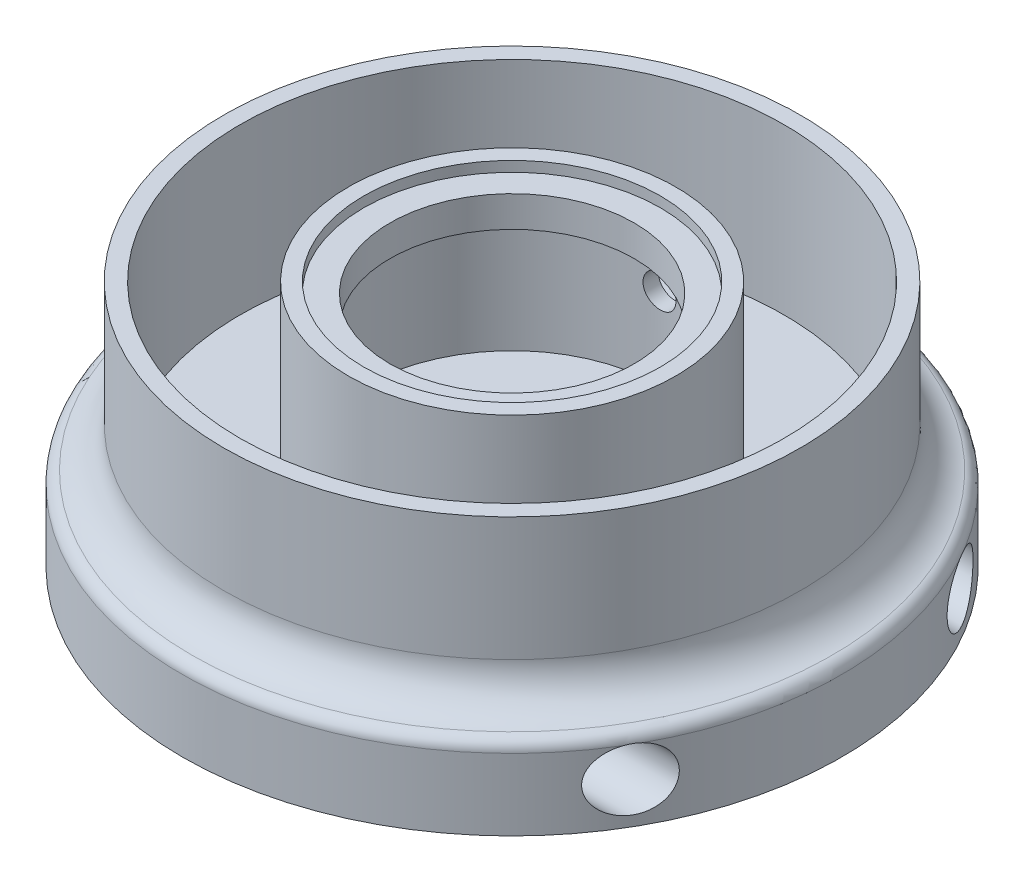
from build123d import *
from build123d.topology import SkipClean

# Parameters (mm, degrees)
SKETCH1_R               = 101.6
BOSS_EXTRUDE1_DEPTH     = 25.4
SKETCH4_R               = 88.9
SKETCH4_R_2             = 83.82
BOSS_EXTRUDE2_DEPTH     = 50.8
CUT_EXTRUDE4_DEPTH      = 101.6
CUT_EXTRUDE4_DEPTH_BACK = 101.6
SKETCH2_R               = 9.525
FILLET7_R               = 12.7
FILLET8_R               = 3.81
SKETCH11_R              = 50.4825
SKETCH11_R_2            = 45.72
BOSS_EXTRUDE5_DEPTH     = 50.8
SKETCH13_W              = 8.068772826
SKETCH13_H              = 9.525
SKETCH14_R              = 5.08
CUT_EXTRUDE5_DEPTH      = 50.8


# Some blends are built 0.0001 mm under size
with BuildPart() as part:
    # Sketch1 → Boss-Extrude1 (new body)
    with BuildSketch(Plane(origin=(0, 0, 0), x_dir=(1, 0, 0), z_dir=(0, 1, 0))):
        with Locations(Location((0, 0, 0), (0, 0, 270))):
            Circle(SKETCH1_R)
    extrude(amount=BOSS_EXTRUDE1_DEPTH)

    # Sketch4 → Boss-Extrude2 (add)
    with BuildSketch(Plane(origin=(0, 25.4, 0), x_dir=(1, 0, 0), z_dir=(0, 1, 0))):
        with Locations(Location((0, 0, 0), (0, 0, 270))):
            Circle(SKETCH4_R)
        with Locations(Location((0, 0, 0), (0, 0, 270))):
            Circle(SKETCH4_R_2, mode=Mode.SUBTRACT)
    extrude(amount=BOSS_EXTRUDE2_DEPTH)

    # Sketch2 → Cut-Extrude4 (cut, two sides: drawn at the far end of the back side and taken through both)
    with BuildSketch(Plane(origin=(0, 0, 0), x_dir=(0, 0, -1), z_dir=(1, 0, 0)).offset(-CUT_EXTRUDE4_DEPTH_BACK)):
        with Locations(Location((50.8, 12.7, 0), (0, 0, 180))):
            Circle(SKETCH2_R)
        with Locations(Location((-50.8, 12.7, 0), (0, 0, 180))):
            Circle(SKETCH2_R)
    extrude(amount=CUT_EXTRUDE4_DEPTH + CUT_EXTRUDE4_DEPTH_BACK, mode=Mode.SUBTRACT)

    # Fillet7
    fillet7_edges = [part.edges().sort_by_distance(p)[0] for p in [
        (0, 25.4, -88.9),
    ]]
    fillet(fillet7_edges, radius=FILLET7_R - 0.0001)  # a hair under: the kernel refuses the full size

    # Fillet8
    # the kernel refuses this fillet: 3.81 mm, written as the material it takes off along each edge
    with BuildSketch(Plane(origin=(0, 25.4, 0), x_dir=(0, 0, 1), z_dir=(-1, 0, 0))) as fillet8_piece_1:
        with BuildLine():
            CenterArc((97.79, -3.364391457), FILLET8_R, 360, 76.657910561)
            Line((101.6, -3.364391457), (101.981, -3.364391457))
            Line((101.981, -3.364391457), (101.981, 0))
            Line((101.981, 0), (101.6, 0.381))
            ThreePointArc((101.6, 0.381), (101.5999, 0.381), (98.757134319, 0.713491843))
            Line((98.757134319, 0.713491843), (98.669213018, 0.34277518))
        make_face()
    revolve(axis=Axis((0, 25.4, 0), (0, 1, 0)), mode=Mode.SUBTRACT)

    # Sketch11 → Boss-Extrude5 (add)
    with SkipClean():  # the faces are left unmerged after this step: merging them gives an invalid solid
        with BuildSketch(Plane(origin=(0, 25.4, 0), x_dir=(1, 0, 0), z_dir=(0, 1, 0))):
            with Locations(Location((0, 0, 0), (0, 0, 270))):
                Circle(SKETCH11_R)
            with Locations(Location((0, 0, 0), (0, 0, 270))):
                Circle(SKETCH11_R_2, mode=Mode.SUBTRACT)
        extrude(amount=BOSS_EXTRUDE5_DEPTH)

    # Sketch13 → Revolve1 (revolve)
    with SkipClean():  # the faces are left unmerged after this step: merging them gives an invalid solid
        with BuildSketch(Plane.XY, mode=Mode.PRIVATE) as revolve1_sk:
            with Locations((41.685613587, 68.2625)):
                Rectangle(SKETCH13_W, SKETCH13_H)
        revolve(revolve1_sk.sketch.rotate(Axis((0, 80.01, 0), (0, -1, 0)), 90), axis=Axis((0, 80.01, 0), (0, -1, 0)))

    # Sketch14 → Cut-Extrude5 (cut)
    with SkipClean():  # the faces are left unmerged after this step: merging them gives an invalid solid
        with BuildSketch(Plane.XY):
            with Locations(Location((0, 50.8, 0), (0, 0, 90))):
                Circle(SKETCH14_R)
        extrude(amount=-CUT_EXTRUDE5_DEPTH, mode=Mode.SUBTRACT)


solid = part.part
